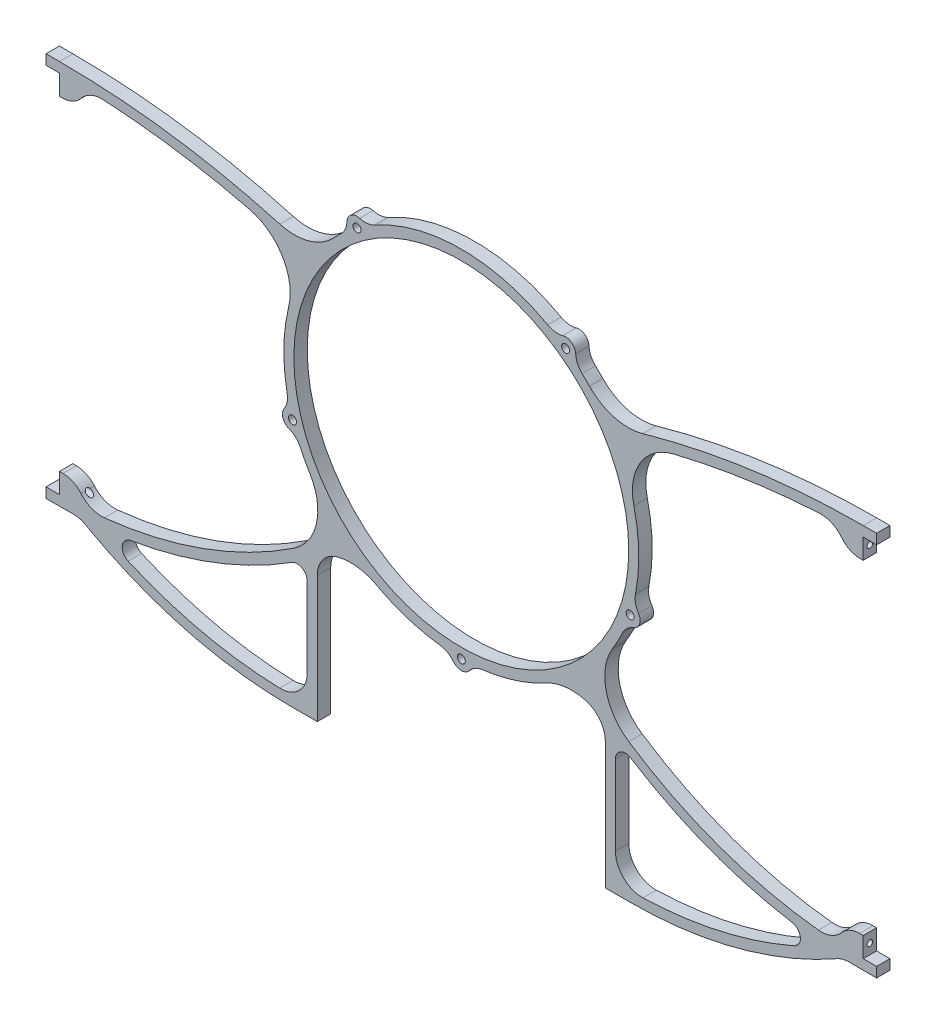
from build123d import *

# Parameters (mm, degrees)
SKETCH1_R                  = 79.375
BOSS_EXTRUDE1_DEPTH        = 6.35
FILLET1_R                  = 25.4
SKETCH2_W                  = 7.9375
SKETCH2_H                  = 11.90625
BOSS_EXTRUDE3_DEPTH        = 6.35
FILLET3_R                  = 12.7
FILLET4_R                  = 11.1125
F_6_32_TAPPED_HOLE1_REACH  = 406.592
F_6_32_TAPPED_HOLE1_BORE_R = 1.35255
BOSS_EXTRUDE4_START        = -6.35
BOSS_EXTRUDE4_DEPTH        = 6.35
FILLET5_R                  = 12.7
F_6_CLEARANCE_HOLE1_D      = 3.7973
F_6_CLEARANCE_HOLE1_DEPTH  = 7.62
F_6_CLEARANCE_HOLE1_TIP    = 1.140824014
FILLET6_R                  = 4.7625
SKETCH14_R                 = 4.7625
BOSS_EXTRUDE5_DEPTH        = 6.35
F_6_CLEARANCE_HOLE3_D      = 3.7973
F_6_CLEARANCE_HOLE3_DEPTH  = 25.4
F_6_CLEARANCE_HOLE3_TIP    = 1.140824014
FILLET7_R                  = 9.525


with BuildPart() as part:
    # Sketch1 → Boss-Extrude1 (new body)
    with BuildSketch(Plane.XY):
        with BuildLine():
            ThreePointArc((-70.124921537, 46.49316386), (-129.536778712, 61.003194837), (-190.5, 65.88125))
            Line((-190.5, 65.88125), (-196.85, 65.88125))
            Line((-196.85, 65.88125), (-196.85, 61.11875))
            Line((-196.85, 61.11875), (-190.5, 61.11875))
            ThreePointArc((-190.5, 61.11875), (-130.862082381, 56.392332943), (-72.713122566, 42.331084477))
            ThreePointArc((-72.713122566, 42.331084477), (-83.239755645, -12.258139599), (-57.423322606, -61.495373218))
            ThreePointArc((-57.423322606, -61.495373218), (-119.3453814, -98.89028357), (-190.5, -111.91875))
            Line((-190.5, -111.91875), (-196.85, -111.91875))
            Line((-196.85, -111.91875), (-196.85, -116.68125))
            Line((-196.85, -116.68125), (-190.5, -116.68125))
            ThreePointArc((-190.5, -116.68125), (-117.381029919, -103.238664942), (-53.824293501, -64.66888228))
            ThreePointArc((-53.824293501, -64.66888228), (0, -84.1375), (53.824293501, -64.66888228))
            ThreePointArc((53.824293501, -64.66888228), (117.381029919, -103.238664942), (190.5, -116.68125))
            Line((190.5, -116.68125), (196.85, -116.68125))
            Line((196.85, -116.68125), (196.85, -111.91875))
            Line((196.85, -111.91875), (190.5, -111.91875))
            ThreePointArc((190.5, -111.91875), (119.3453814, -98.89028357), (57.423322606, -61.495373218))
            ThreePointArc((57.423322606, -61.495373218), (83.239755645, -12.258139599), (72.713122566, 42.331084477))
            ThreePointArc((72.713122566, 42.331084477), (130.862082381, 56.392332943), (190.5, 61.11875))
            Line((190.5, 61.11875), (196.85, 61.11875))
            Line((196.85, 61.11875), (196.85, 65.88125))
            Line((196.85, 65.88125), (190.5, 65.88125))
            ThreePointArc((190.5, 65.88125), (129.536778712, 61.003194837), (70.124921537, 46.49316386))
            ThreePointArc((70.124921537, 46.49316386), (0, 84.1375), (-70.124921537, 46.49316386))
        make_face()
        Circle(SKETCH1_R, mode=Mode.SUBTRACT)
    extrude(amount=BOSS_EXTRUDE1_DEPTH)

    # Fillet1
    fillet1_edges = [part.edges().sort_by_distance(p)[0] for p in [
        (57.423322606, -61.495373218, 3.175),
        (53.824293501, -64.66888228, 3.175),
        (-53.824293501, -64.66888228, 3.175),
        (-57.423322606, -61.495373218, 3.175),
        (-72.713122566, 42.331084477, 3.175),
        (-70.124921537, 46.49316386, 3.175),
        (70.124921537, 46.49316386, 3.175),
        (72.713122566, 42.331084477, 3.175),
    ]]
    fillet(fillet1_edges, radius=FILLET1_R)

    # Sketch2 → Boss-Extrude3 (add, through all)
    with BuildSketch(Plane.XY.offset(6.35)):
        with Locations((-186.53125, 57.546875)):
            Rectangle(SKETCH2_W, SKETCH2_H)
        with Locations((-186.53125, -108.346875)):
            Rectangle(SKETCH2_W, SKETCH2_H)
        with Locations((186.53125, -108.346875)):
            Rectangle(SKETCH2_W, SKETCH2_H)
        with Locations((186.53125, 57.546875)):
            Rectangle(SKETCH2_W, SKETCH2_H)
    extrude(amount=-BOSS_EXTRUDE3_DEPTH)

    # Fillet3
    # the kernel refuses this fillet: 12.7 mm, written as the material it adds along each edge
    with BuildSketch(Plane(origin=(182.5625, -111.761821095, 6.35), x_dir=(-0.9973519325166305, 0.07272635495707497, 0), z_dir=(0, 0, -1))) as fillet3_piece_1:
        with BuildLine():
            CenterArc((12.931587798, 12.692978371), FILLET3_R, 195.293109705, 76.61224008)
            Line((0.681305664, 9.343263811), (0.436300021, 9.27626952))
            ThreePointArc((0.436300021, 9.27626952), (0.087325441, 4.6901044), (-0.253327391, 0.018472494))
            Line((-0.253327391, 0.018472494), (-0.008445119, -0.253859567))
            ThreePointArc((-0.008445119, -0.253859567), (6.676921863, -0.365029506), (13.362288844, -0.253859567))
            Line((13.362288844, -0.253859567), (13.353843726, 0))
        make_face()
    extrude(amount=6.35)
    with BuildSketch(Plane(origin=(-182.5625, -111.761821095, 6.35), x_dir=(0.9973519325166303, 0.07272635495707692, 0), z_dir=(0, 0, -1))) as fillet3_piece_2:
        with BuildLine():
            CenterArc((12.931587798, -12.692978371), FILLET3_R, 88.094650215, 76.61224008)
            Line((0.681305664, -9.343263811), (0.436300021, -9.27626952))
            ThreePointArc((0.436300021, -9.27626952), (0.087325441, -4.6901044), (-0.253327391, -0.018472494))
            Line((-0.253327391, -0.018472494), (-0.008445119, 0.253859567))
            ThreePointArc((-0.008445119, 0.253859567), (6.676921863, 0.365029506), (13.362288844, 0.253859567))
            Line((13.362288844, 0.253859567), (13.353843726, 0))
        make_face()
    extrude(amount=6.35)
    with BuildSketch(Plane(origin=(182.5625, 61.03553855, 6.35), x_dir=(-0.9992806481695288, -0.03792342539758774, 0), z_dir=(0, 0, -1))) as fillet3_piece_3:
        with BuildLine():
            CenterArc((12.631682425, -12.698172092), FILLET3_R, 89.027884001, 76.083371165)
            Line((0.358064964, -9.434996582), (0.112592614, -9.369733072))
            ThreePointArc((0.112592614, -9.369733072), (-0.074784803, -4.727130841), (-0.253817285, -0.00963255))
            Line((-0.253817285, -0.00963255), (-0.004309316, 0.253963442))
            ThreePointArc((-0.004309316, 0.253963442), (6.423574112, 0.308494493), (12.851457539, 0.253963442))
            Line((12.851457539, 0.253963442), (12.847148223, 0))
        make_face()
    extrude(amount=6.35)
    with BuildSketch(Plane(origin=(-182.5625, 61.03553855, 6.35), x_dir=(0.9992806481695288, -0.03792342539758774, 0), z_dir=(0, 0, -1))) as fillet3_piece_4:
        with BuildLine():
            CenterArc((12.631682425, 12.698172092), FILLET3_R, 194.888744835, 76.083371165)
            Line((0.358064964, 9.434996582), (0.112592614, 9.369733072))
            ThreePointArc((0.112592614, 9.369733072), (-0.074784803, 4.727130841), (-0.253817285, 0.00963255))
            Line((-0.253817285, 0.00963255), (-0.004309316, -0.253963442))
            ThreePointArc((-0.004309316, -0.253963442), (6.423574112, -0.308494493), (12.851457539, -0.253963442))
            Line((12.851457539, -0.253963442), (12.847148223, 0))
        make_face()
    extrude(amount=6.35)

    # Fillet4
    fillet4_edges = [part.edges().sort_by_distance(p)[0] for p in [
        (-182.5625, 51.59375, 3.175),
        (-182.5625, -102.39375, 3.175),
        (182.5625, -102.39375, 3.175),
        (182.5625, 51.59375, 3.175),
    ]]
    fillet(fillet4_edges, radius=FILLET4_R)

    # #6-32 Tapped Hole1 bore → #6-32 Tapped Hole1 (cut, up to next)
    with BuildSketch(Plane(origin=(190.5, 0, 0), x_dir=(0, 0, -1), z_dir=(1, 0, 0)), mode=Mode.PRIVATE) as f_6_32_tapped_hole1_sk1:
        with Locations((-3.175, 56.35625)):
            Circle(F_6_32_TAPPED_HOLE1_BORE_R)
    f_6_32_tapped_hole1_tool1 = extrude(f_6_32_tapped_hole1_sk1.sketch, amount=-F_6_32_TAPPED_HOLE1_REACH, mode=Mode.PRIVATE) & part.part
    # #6-32 Tapped Hole1 bore → #6-32 Tapped Hole1 (cut, up to next)
    with BuildSketch(Plane(origin=(190.5, 0, 0), x_dir=(0, 0, -1), z_dir=(1, 0, 0)), mode=Mode.PRIVATE) as f_6_32_tapped_hole1_sk2:
        with Locations((-3.175, -107.15625)):
            Circle(F_6_32_TAPPED_HOLE1_BORE_R)
    f_6_32_tapped_hole1_tool2 = extrude(f_6_32_tapped_hole1_sk2.sketch, amount=-F_6_32_TAPPED_HOLE1_REACH, mode=Mode.PRIVATE) & part.part
    f_6_32_tapped_hole1_1 = f_6_32_tapped_hole1_tool1.solids().sort_by_distance((190.5, 56.35625, 3.175))[0]
    add(f_6_32_tapped_hole1_1, mode=Mode.SUBTRACT)
    f_6_32_tapped_hole1_2 = f_6_32_tapped_hole1_tool2.solids().sort_by_distance((190.5, -107.15625, 3.175))[0]
    add(f_6_32_tapped_hole1_2, mode=Mode.SUBTRACT)
    f_6_32_tapped_hole1 = f_6_32_tapped_hole1_1 + f_6_32_tapped_hole1_2  # #6-32 Tapped Hole1 as one shape, for the pattern or mirror that repeats it

    # Mirror1: #6-32 Tapped Hole1 across plane
    add(f_6_32_tapped_hole1.mirror(Plane(origin=(0, 0, 0), x_dir=(0, 0, 1), z_dir=(1, 0, 0))), mode=Mode.SUBTRACT)

    # Sketch10 → Boss-Extrude4 (add)
    with BuildSketch(Plane.XY.offset(6.35).offset(BOSS_EXTRUDE4_START)):
        with BuildLine():
            Line((-80.16875, -144.008582157), (-68.2625, -144.008582157))
            Line((-68.2625, -144.008582157), (-68.2625, -76.392601))
            ThreePointArc((-68.2625, -76.392601), (-70.631566354, -78.118588686), (-73.025, -79.810624226))
            Line((-73.025, -79.810624226), (-73.025, -139.246082157))
            Line((-73.025, -139.246082157), (-80.16875, -139.246082157))
            ThreePointArc((-80.16875, -139.246082157), (-127.711762798, -133.312942803), (-172.338484416, -115.877463856))
            ThreePointArc((-172.338484416, -115.877463856), (-174.490938831, -116.056971855), (-176.645160409, -116.21385563))
            ThreePointArc((-176.645160409, -116.21385563), (-178.809429864, -116.348583239), (-180.975, -116.460475084))
            ThreePointArc((-180.975, -116.460475084), (-132.420061568, -136.997561621), (-80.16875, -144.008582157))
        make_face()
        with BuildLine():
            Line((73.025, -139.246082157), (73.025, -79.810624226))
            ThreePointArc((73.025, -79.810624226), (70.631566354, -78.118588686), (68.2625, -76.392601))
            Line((68.2625, -76.392601), (68.2625, -144.008582157))
            Line((68.2625, -144.008582157), (80.16875, -144.008582157))
            ThreePointArc((80.16875, -144.008582157), (132.420061568, -136.997561621), (180.975, -116.460475084))
            ThreePointArc((180.975, -116.460475084), (178.809429864, -116.348583239), (176.645160409, -116.21385563))
            ThreePointArc((176.645160409, -116.21385563), (174.490938831, -116.056971855), (172.338484416, -115.877463856))
            ThreePointArc((172.338484416, -115.877463856), (127.711762798, -133.312942803), (80.16875, -139.246082157))
            Line((80.16875, -139.246082157), (73.025, -139.246082157))
        make_face()
    extrude(amount=BOSS_EXTRUDE4_DEPTH)

    # Fillet5
    fillet5_edges = [part.edges().sort_by_distance(p)[0] for p in [
        (-73.025, -139.246082157, 3.175),
        (73.025, -139.246082157, 3.175),
        (-180.975, -116.460475084, 3.175),
        (180.975, -116.460475084, 3.175),
        (68.2625, -76.392601, 3.175),
        (-68.2625, -76.392601, 3.175),
    ]]
    fillet(fillet5_edges, radius=FILLET5_R)

    # #6 Clearance Hole1
    with Locations(Plane(origin=(0, -144.008582157, 0), x_dir=(-1, 0, 0), z_dir=(0, -1, 0))):
        with Locations((73.7489, -3.175), (-73.7489, -3.175)):
            Hole(F_6_CLEARANCE_HOLE1_D / 2, depth=F_6_CLEARANCE_HOLE1_DEPTH)
            with Locations((0, 0, -(F_6_CLEARANCE_HOLE1_DEPTH + F_6_CLEARANCE_HOLE1_TIP / 2))):  # 118° drill point
                Cone(0, F_6_CLEARANCE_HOLE1_D / 2, F_6_CLEARANCE_HOLE1_TIP, mode=Mode.SUBTRACT)

    # Fillet6
    fillet6_edges = [part.edges().sort_by_distance(p)[0] for p in [
        (172.338484416, -115.877463856, 3.175),
        (73.025, -79.810624226, 3.175),
        (-73.025, -79.810624226, 3.175),
        (-172.338484416, -115.877463856, 3.175),
    ]]
    fillet(fillet6_edges, radius=FILLET6_R)

    # Sketch14 → Boss-Extrude5 (add)
    with BuildSketch(Plane.XY.offset(6.35)):
        with Locations((-80.01951764, -25.999917364)):
            Circle(SKETCH14_R)
        with Locations((-49.454781665, 68.068667364)):
            Circle(SKETCH14_R)
        with Locations((49.454781665, 68.068667364)):
            Circle(SKETCH14_R)
        with Locations((0, -84.1375)):
            Circle(SKETCH14_R)
        with Locations((80.01951764, -25.999917364)):
            Circle(SKETCH14_R)
    extrude(amount=-BOSS_EXTRUDE5_DEPTH)

    # #6 Clearance Hole3
    with Locations(Plane.XY.offset(6.35)):
        with Locations((-49.454781665, 68.068667364), (49.454781665, 68.068667364), (80.01951764, -25.999917364), (0, -84.1375), (-80.01951764, -25.999917364)):
            Hole(F_6_CLEARANCE_HOLE3_D / 2, depth=F_6_CLEARANCE_HOLE3_DEPTH)
            with Locations((0, 0, -(F_6_CLEARANCE_HOLE3_DEPTH + F_6_CLEARANCE_HOLE3_TIP / 2))):  # 118° drill point
                Cone(0, F_6_CLEARANCE_HOLE3_D / 2, F_6_CLEARANCE_HOLE3_TIP, mode=Mode.SUBTRACT)

    # Fillet7
    fillet7_edges = [part.edges().sort_by_distance(p)[0] for p in [
        (-81.362430792, -21.430673388, 3.175),
        (-78.420222979, -30.485857939, 3.175),
        (-45.524155393, 70.757827709, 3.175),
        (-53.22695545, 65.161415882, 3.175),
        (53.22695545, 65.161415882, 3.175),
        (45.524155393, 70.757827709, 3.175),
        (-4.760592244, -84.002712264, 3.175),
        (4.760592244, -84.002712264, 3.175),
        (78.420222979, -30.485857939, 3.175),
        (81.362430792, -21.430673388, 3.175),
    ]]
    fillet(fillet7_edges, radius=FILLET7_R)


solid = part.part
